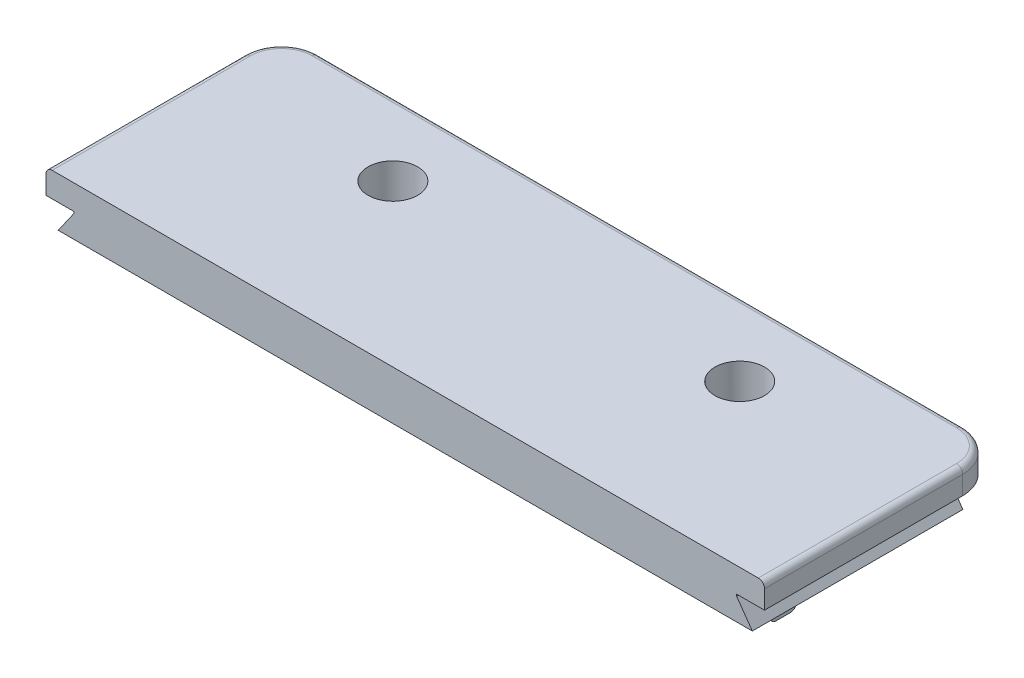
from build123d import *

# Parameters (mm, degrees)
BOSS_EXTRUDE1_DEPTH = 17
SKETCH3_W           = 58
SKETCH3_H           = 2
BOSS_EXTRUDE2_DEPTH = 2
FILLET1_R           = 3
SKETCH4_W           = 56.032437302
SKETCH4_H           = 2
BOSS_EXTRUDE3_DEPTH = 0.25
FILLET2_R           = 0.5
CUT_EXTRUDE2_REACH  = 36.923
SKETCH7_R           = 2
FILLET3_R           = 0.5


with BuildPart() as part:
    # Sketch1 → Boss-Extrude1 (new body)
    with BuildSketch(Plane.XY):
        Polygon((-26.755845082, 29), (-28.016218651, 27.2), (28.016218651, 27.2), (26.755845082, 29), (26.755845082, 29.15), (29, 29.15), (29, 31.15), (-29, 31.15), (-29, 29.15), (-26.755845082, 29.15), align=None)
    extrude(amount=-BOSS_EXTRUDE1_DEPTH)

    # Sketch3 → Boss-Extrude2 (add)
    with BuildSketch(Plane(origin=(0, 0, -17), x_dir=(-1, 0, 0), z_dir=(0, 0, -1))):
        with Locations((0, 30.15)):
            Rectangle(SKETCH3_W, SKETCH3_H)
    extrude(amount=BOSS_EXTRUDE2_DEPTH)

    # Fillet1
    fillet1_edges = [part.edges().sort_by_distance(p)[0] for p in [
        (29, 30.15, -19),
        (-29, 30.15, -19),
    ]]
    fillet(fillet1_edges, radius=FILLET1_R)

    # Sketch4 → Boss-Extrude3 (add)
    with BuildSketch(Plane.XZ.offset(-27.2)):
        with Locations((0, -2.5)):
            Rectangle(SKETCH4_W, SKETCH4_H)
    extrude(amount=BOSS_EXTRUDE3_DEPTH)

    # Fillet2
    # the kernel refuses this fillet: 0.5 mm, written as the material it takes off along each edge
    with BuildSketch(Plane(origin=(-29.098750406, 26.95, -3.5), x_dir=(0, 1, 0), z_dir=(1, 0, 0)), Plane(origin=(29.098750406, 26.95, -1.5), x_dir=(0, 1, 0), z_dir=(-1, 0, 0))) as fillet2_piece_1:
        with BuildLine():
            CenterArc((0.5, 0.433012702), FILLET2_R, 180, 60)
            Line((0, 0.433012702), (-0.01, 0.433012702))
            Line((-0.01, 0.433012702), (-0.01, 0))
            Line((-0.01, 0), (0, -0.01))
            ThreePointArc((0, -0.01), (0.125, -0.01), (0.245, -0.008660254))
            Line((0.245, -0.008660254), (0.25, 0))
        make_face()
    extrude(amount=58.197500812, mode=Mode.SUBTRACT)

    # Sketch7 → Cut-Extrude2 (cut, up to next)
    with BuildSketch(Plane(origin=(0, 31.15, 0), x_dir=(1, 0, 0), z_dir=(0, 1, 0)), mode=Mode.PRIVATE) as cut_extrude2_sk1:
        with Locations(Location((14, 13, 0), (0, 0, 270))):
            Circle(SKETCH7_R)
    cut_extrude2_tool1 = extrude(cut_extrude2_sk1.sketch, amount=-CUT_EXTRUDE2_REACH, mode=Mode.PRIVATE) & part.part
    # Sketch7 → Cut-Extrude2 (cut, up to next)
    with BuildSketch(Plane(origin=(0, 31.15, 0), x_dir=(1, 0, 0), z_dir=(0, 1, 0)), mode=Mode.PRIVATE) as cut_extrude2_sk2:
        with Locations((-14, 13)):
            Circle(SKETCH7_R)
    cut_extrude2_tool2 = extrude(cut_extrude2_sk2.sketch, amount=-CUT_EXTRUDE2_REACH, mode=Mode.PRIVATE) & part.part
    add(cut_extrude2_tool1.solids().sort_by_distance((14, 31.15, -13))[0], mode=Mode.SUBTRACT)
    add(cut_extrude2_tool2.solids().sort_by_distance((-14, 31.15, -13))[0], mode=Mode.SUBTRACT)

    # Fillet3
    fillet3_edges = [part.edges().sort_by_distance(p)[0] for p in [
        (0, 31.15, -19),
        (29, 31.15, -8),
        (-29, 31.15, -8),
        (-28.121320344, 31.15, -18.121320344),
        (28.121320344, 31.15, -18.121320344),
    ]]
    fillet(fillet3_edges, radius=FILLET3_R)


solid = part.part
